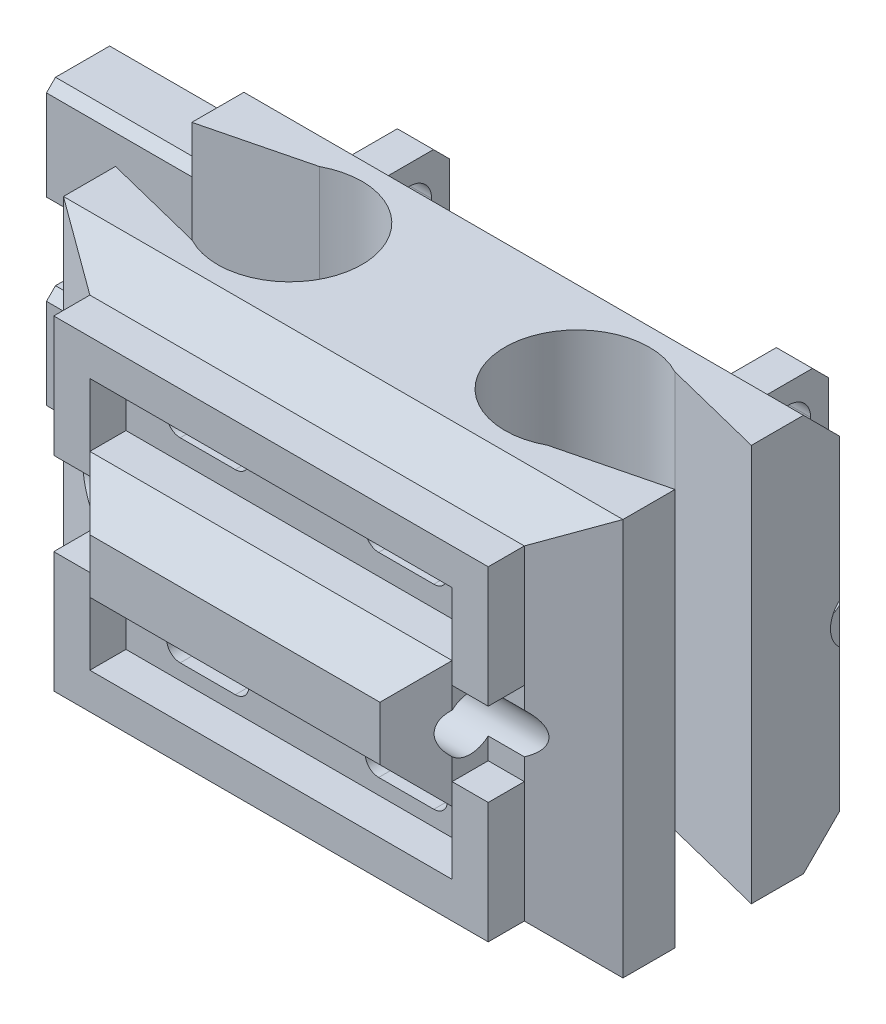
from build123d import *
from OCP.BRepFilletAPI import BRepFilletAPI_MakeChamfer

# Parameters (mm, degrees)
BASE_W                           = 15.5
BASE_H                           = 11
PHALANGE_SHAPE_DEPTH             = 7
CHAMFER4_SIZE                    = 1
CHAMFER5_SIZE                    = 1
CHAMFER5_SIZE2                   = 1.732050808
CHAMFER6_SIZE                    = 1
SKETCH8_W                        = 10.035898384
SKETCH8_H                        = 3.5
LIGAMENT_INSIDE_DEPTH            = 2
LIGAMENT_INSIDE_HOLE_DEPTH       = 4.254422658
LIGAMENT_INSIDE_HOLE_DEPTH_BACK  = 34.5
SKETCH9_R                        = 0.75
CHAMFER9_SIZE                    = 1
SKETCH10_W                       = 13.5
SKETCH10_H                       = 3.5
LIGAMENT_OUTSIDE_DEPTH           = 2
LIGAMENT_OUTSIDE_HOLE_DEPTH      = 2.5
LIGAMENT_OUTSIDE_HOLE_DEPTH_BACK = 36.5
SKETCH11_R                       = 0.75
CHAMFER11_SIZE                   = 1
TENDONS_FIXATION_DEPTH           = 11
SKETCH12_W                       = 1
SKETCH12_H                       = 3.75
BOSS_EXTRUDE7_DEPTH              = 2
TOUCH_SENSOR_WIRE_GAUGE_DEPTH    = 12
CHAMFER12_SIZE                   = 0.3
CHAMFER13_SIZE                   = 0.75
SKETCH15_W                       = 2
SKETCH15_H                       = 3
BOSS_EXTRUDE8_DEPTH              = 4.47
CHAMFER14_SIZE                   = 0.25
CHAMFER15_SIZE                   = 0.5
SKETCH16_W                       = 1
SKETCH16_H                       = 2.345491503
SKETCH16_W_2                     = 12.035898384
SKETCH16_H_2                     = 1
BOSS_EXTRUDE9_DEPTH              = 1
CUT_EXTRUDE1_DEPTH               = 1


with BuildPart() as part:
    # Base → Phalange shape (new body)
    with BuildSketch(Plane.XY):
        with Locations((7.75, 5.5)):
            Rectangle(BASE_W, BASE_H)
    extrude(amount=PHALANGE_SHAPE_DEPTH)

    # Chamfer4
    chamfer4_edges = [part.edges().sort_by_distance(p)[0] for p in [
        (7.75, 11, 7),
        (7.75, 0, 7),
    ]]
    chamfer(chamfer4_edges, length=CHAMFER4_SIZE)

    # Chamfer5: one chamfer whose edges measure the first distance from different faces: ONE call of the kernel's chamfer builder (chamfer() names one face for all edges)
    chamfer5_edges_1 = [part.edges().sort_by_distance(p)[0] for p in [
        (0, 5.5, 7),
    ]]
    chamfer5_side_1 = [part.faces().sort_by_distance(p)[0] for p in [
        (0, 5.5, 3.458333333),
    ]]
    chamfer5_edges_2 = [part.edges().sort_by_distance(p)[0] for p in [
        (15.5, 5.5, 7),
    ]]
    chamfer5_side_2 = [part.faces().sort_by_distance(p)[0] for p in [
        (15.5, 5.5, 3.458333333),
    ]]
    chamfer5 = BRepFilletAPI_MakeChamfer(part.part.solid().wrapped)
    for e in chamfer5_edges_1:
        chamfer5.Add(CHAMFER5_SIZE, CHAMFER5_SIZE2, e.wrapped, chamfer5_side_1[0].wrapped)  # the first distance lies on this face
    for e in chamfer5_edges_2:
        chamfer5.Add(CHAMFER5_SIZE, CHAMFER5_SIZE2, e.wrapped, chamfer5_side_2[0].wrapped)  # the first distance lies on this face
    add(Compound.cast(chamfer5.Shape()), mode=Mode.REPLACE)

    # Chamfer6
    chamfer6_edges = [part.edges().sort_by_distance(p)[0] for p in [
        (7.75, 11, 0),
        (7.75, 0, 0),
    ]]
    chamfer(chamfer6_edges, length=CHAMFER6_SIZE)

    # Sketch8 → Ligament inside (add)
    with BuildSketch(Plane.XY.offset(7)):
        with Locations((7.75, 5.5)):
            Rectangle(SKETCH8_W, SKETCH8_H)
    extrude(amount=LIGAMENT_INSIDE_DEPTH)

    # Sketch9 → Ligament inside hole (cut, two sides: drawn at the far end of the back side and taken through both)
    with BuildSketch(Plane(origin=(12.767949192, 0, 0), x_dir=(0, 0, -1), z_dir=(1, 0, 0)).offset(-LIGAMENT_INSIDE_HOLE_DEPTH_BACK)):
        with Locations(Location((-7.5, 5.5, 0), (0, 0, 311.810314896))):
            Circle(SKETCH9_R)
    extrude(amount=LIGAMENT_INSIDE_HOLE_DEPTH + LIGAMENT_INSIDE_HOLE_DEPTH_BACK, mode=Mode.SUBTRACT)

    # Chamfer9
    # the kernel refuses this chamfer: 1 mm, written as the material it takes off along each edge
    with BuildSketch(Plane(origin=(15.33963218, 3.75, 9), x_dir=(0, -0.027495876610586487, -0.9996219169112968), z_dir=(-1, 0, 0)), Plane(origin=(0.16036782, 7.25, 9), x_dir=(0, 0.027495876610586487, -0.9996219169112968), z_dir=(1, 0, 0))) as chamfer9_piece_1:
        Polygon((CHAMFER9_SIZE * 0.999621916911, -CHAMFER9_SIZE * 0.0274958766106), (-CHAMFER9_SIZE * 0.0274958766106, -CHAMFER9_SIZE * 0.999621916911), (0, 0), align=None)
    extrude(amount=15.179264361, mode=Mode.SUBTRACT)
    with BuildSketch(Plane(origin=(12.767949192, 9.821682988, 9), x_dir=(0.027495876610585623, 0, -0.9996219169112968), z_dir=(0, -1, 0)), Plane(origin=(2.732050808, 1.178317012, 9), x_dir=(-0.027495876610586487, 0, -0.9996219169112968), z_dir=(0, 1, 0))) as chamfer9_piece_2:
        Polygon((CHAMFER9_SIZE * 0.999621916911, -CHAMFER9_SIZE * 0.0274958766106), (-CHAMFER9_SIZE * 0.0274958766106, -CHAMFER9_SIZE * 0.999621916911), (0, 0), align=None)
    extrude(amount=8.643365976, mode=Mode.SUBTRACT)

    # Sketch10 → Ligament outside (add)
    with BuildSketch(Plane(origin=(0, 0, 0), x_dir=(-1, 0, 0), z_dir=(0, 0, -1))):
        with Locations((-7.75, 5.5)):
            Rectangle(SKETCH10_W, SKETCH10_H)
    extrude(amount=LIGAMENT_OUTSIDE_DEPTH)

    # Sketch11 → Ligament outside hole (cut, two sides: drawn at the far end of the back side and taken through both)
    with BuildSketch(Plane.ZY.offset(-1).offset(-LIGAMENT_OUTSIDE_HOLE_DEPTH_BACK)):
        with Locations(Location((-0.5, 5.5, 0), (0, 0, 48.189685104))):
            Circle(SKETCH11_R)
    extrude(amount=LIGAMENT_OUTSIDE_HOLE_DEPTH + LIGAMENT_OUTSIDE_HOLE_DEPTH_BACK, mode=Mode.SUBTRACT)

    # Chamfer11
    # the kernel refuses this chamfer: 1 mm, written as the material it takes off along each edge
    with BuildSketch(Plane(origin=(14.5, 9.821682988, -2), x_dir=(0.027495876610585623, 0, 0.9996219169112968), z_dir=(0, -1, 0)), Plane(origin=(1, 1.178317012, -2), x_dir=(-0.02749587661058638, 0, 0.9996219169112968), z_dir=(0, 1, 0))) as chamfer11_piece_1:
        Polygon((CHAMFER11_SIZE * 0.999621916911, CHAMFER11_SIZE * 0.0274958766106), (-CHAMFER11_SIZE * 0.0274958766106, CHAMFER11_SIZE * 0.999621916911), (0, 0), align=None)
    extrude(amount=8.643365976, mode=Mode.SUBTRACT)
    with BuildSketch(Plane(origin=(17.071682988, 3.75, -2), x_dir=(0, -0.027495876610586487, 0.9996219169112968), z_dir=(-1, 0, 0)), Plane(origin=(-1.571682988, 7.25, -2), x_dir=(0, 0.027495876610586487, 0.9996219169112968), z_dir=(1, 0, 0))) as chamfer11_piece_2:
        Polygon((CHAMFER11_SIZE * 0.999621916911, CHAMFER11_SIZE * 0.0274958766106), (-CHAMFER11_SIZE * 0.0274958766106, CHAMFER11_SIZE * 0.999621916911), (0, 0), align=None)
    extrude(amount=18.643365976, mode=Mode.SUBTRACT)

    # Tendon extrude → Tendons fixation (cut)
    with BuildSketch(Plane.XZ):
        with BuildLine():
            Line((2.828823529, 5.264705882), (0, 4.5575))
            Line((0, 4.5575), (0, 2.4425))
            Line((0, 2.4425), (2.828823529, 1.735294118))
            ThreePointArc((2.828823529, 1.735294118), (5.77, 3.5), (2.828823529, 5.264705882))
        make_face()
        with BuildLine():
            Line((12.671176471, 1.735294118), (15.5, 2.4425))
            Line((15.5, 2.4425), (15.5, 4.5575))
            Line((15.5, 4.5575), (12.671176471, 5.264705882))
            ThreePointArc((12.671176471, 5.264705882), (9.73, 3.5), (12.671176471, 1.735294118))
        make_face()
    extrude(amount=-TENDONS_FIXATION_DEPTH, mode=Mode.SUBTRACT)

    # Sketch12 → Boss-Extrude7 (add)
    with BuildSketch(Plane(origin=(0, 0, 0), x_dir=(-1, 0, 0), z_dir=(0, 0, -1))):
        with Locations((-2.5, 8.125)):
            Rectangle(SKETCH12_W, SKETCH12_H)
        with Locations((-2.5, 2.875)):
            Rectangle(SKETCH12_W, SKETCH12_H)
        with Locations((-13, 2.875)):
            Rectangle(SKETCH12_W, SKETCH12_H)
        with Locations((-13, 8.125)):
            Rectangle(SKETCH12_W, SKETCH12_H)
    extrude(amount=BOSS_EXTRUDE7_DEPTH)

    # Sketch13 → Touch sensor wire gauge (cut)
    with BuildSketch(Plane.ZY.offset(-2)):
        with BuildLine():
            Line((0, 8.85), (0, 7.85))
            ThreePointArc((0, 7.85), (-0.6, 7.25), (-1.2, 7.85))
            Line((-1.2, 7.85), (-1.2, 8.85))
            ThreePointArc((-1.2, 8.85), (-0.6, 9.45), (0, 8.85))
        make_face()
        with BuildLine():
            Line((0, 3.15), (0, 2.15))
            ThreePointArc((0, 2.15), (-0.6, 1.55), (-1.2, 2.15))
            Line((-1.2, 2.15), (-1.2, 3.15))
            ThreePointArc((-1.2, 3.15), (-0.6, 3.75), (0, 3.15))
        make_face()
    extrude(amount=-TOUCH_SENSOR_WIRE_GAUGE_DEPTH, mode=Mode.SUBTRACT)

    # Chamfer12
    # the kernel refuses this chamfer: 0.3 mm, written as the material it takes off along each edge
    with BuildSketch(Plane(origin=(2, 6.25, -2), x_dir=(-0.027495876610586622, 0, 0.9996219169112968), z_dir=(0, 1, 0))) as chamfer12_piece_1_section:
        Polygon((CHAMFER12_SIZE * 0.999621916911, CHAMFER12_SIZE * 0.0274958766106), (-CHAMFER12_SIZE * 0.0274958766106, CHAMFER12_SIZE * 0.999621916911), (0, 0), align=None)
    chamfer12_piece_1 = extrude(amount=4.521504896, mode=Mode.PRIVATE)
    chamfer12_piece_1 = split(chamfer12_piece_1, bisect_by=Plane(origin=(2.100684932, 7.261472603, -0.988527397), z_dir=(0, 0.7071067811862649, -0.7071067811868302)), keep=Keep.TOP, mode=Mode.PRIVATE)
    add(chamfer12_piece_1, mode=Mode.SUBTRACT)
    with BuildSketch(Plane(origin=(3, 10.771504896, -2), x_dir=(0.027495876610585904, 0, 0.9996219169112968), z_dir=(0, -1, 0))) as chamfer12_piece_2_section:
        Polygon((CHAMFER12_SIZE * 0.999621916911, CHAMFER12_SIZE * 0.0274958766106), (-CHAMFER12_SIZE * 0.0274958766106, CHAMFER12_SIZE * 0.999621916911), (0, 0), align=None)
    chamfer12_piece_2 = extrude(amount=5.293009793, mode=Mode.PRIVATE)
    chamfer12_piece_2 = split(chamfer12_piece_2, bisect_by=Plane(origin=(2.899315068, 7.261472603, -0.988527397), z_dir=(0, 0.7071067811862649, -0.7071067811868302)), keep=Keep.TOP, mode=Mode.PRIVATE)
    add(chamfer12_piece_2, mode=Mode.SUBTRACT)
    with BuildSketch(Plane(origin=(2, 0.228495104, -2), x_dir=(-0.027495876610586622, 0, 0.9996219169112968), z_dir=(0, 1, 0))) as chamfer12_piece_3_section:
        Polygon((CHAMFER12_SIZE * 0.999621916911, CHAMFER12_SIZE * 0.0274958766106), (-CHAMFER12_SIZE * 0.0274958766106, CHAMFER12_SIZE * 0.999621916911), (0, 0), align=None)
    chamfer12_piece_3 = extrude(amount=4.521504896, mode=Mode.PRIVATE)
    chamfer12_piece_3 = split(chamfer12_piece_3, bisect_by=Plane(origin=(2.100684932, 3.738527397, -0.988527397), z_dir=(0, -0.7071067811862649, -0.7071067811868302)), keep=Keep.TOP, mode=Mode.PRIVATE)
    add(chamfer12_piece_3, mode=Mode.SUBTRACT)
    with BuildSketch(Plane(origin=(3, 5.521504896, -2), x_dir=(-0.9996219169112968, 0, -0.027495876610585942), z_dir=(0, -1, 0))) as chamfer12_piece_4_section:
        Polygon((CHAMFER12_SIZE * 0.999621916911, -CHAMFER12_SIZE * 0.0274958766106), (-CHAMFER12_SIZE * 0.0274958766106, -CHAMFER12_SIZE * 0.999621916911), (0, 0), align=None)
    chamfer12_piece_4 = extrude(amount=5.293009793, mode=Mode.PRIVATE)
    chamfer12_piece_4 = split(chamfer12_piece_4, bisect_by=Plane(origin=(2.899315068, 3.738527397, -0.988527397), z_dir=(0, -0.7071067811862649, -0.7071067811868302)), keep=Keep.TOP, mode=Mode.PRIVATE)
    add(chamfer12_piece_4, mode=Mode.SUBTRACT)
    with BuildSketch(Plane(origin=(13.5, 4.75, -2), x_dir=(0.027495876610584464, 0, 0.9996219169112968), z_dir=(0, -1, 0))) as chamfer12_piece_5_section:
        Polygon((CHAMFER12_SIZE * 0.999621916911, CHAMFER12_SIZE * 0.0274958766106), (-CHAMFER12_SIZE * 0.0274958766106, CHAMFER12_SIZE * 0.999621916911), (0, 0), align=None)
    chamfer12_piece_5 = extrude(amount=4.521504896, mode=Mode.PRIVATE)
    chamfer12_piece_5 = split(chamfer12_piece_5, bisect_by=Plane(origin=(13.399315068, 3.738527397, -0.988527397), z_dir=(0, -0.7071067811862649, -0.7071067811868302)), keep=Keep.TOP, mode=Mode.PRIVATE)
    add(chamfer12_piece_5, mode=Mode.SUBTRACT)
    with BuildSketch(Plane(origin=(12.5, 0.228495104, -2), x_dir=(-0.027495876610584464, 0, 0.9996219169112968), z_dir=(0, 1, 0))) as chamfer12_piece_6_section:
        Polygon((CHAMFER12_SIZE * 0.999621916911, CHAMFER12_SIZE * 0.0274958766106), (-CHAMFER12_SIZE * 0.0274958766106, CHAMFER12_SIZE * 0.999621916911), (0, 0), align=None)
    chamfer12_piece_6 = extrude(amount=5.293009793, mode=Mode.PRIVATE)
    chamfer12_piece_6 = split(chamfer12_piece_6, bisect_by=Plane(origin=(12.600684932, 3.738527397, -0.988527397), z_dir=(0, -0.7071067811862649, -0.7071067811868302)), keep=Keep.TOP, mode=Mode.PRIVATE)
    add(chamfer12_piece_6, mode=Mode.SUBTRACT)
    with BuildSketch(Plane(origin=(13.5, 6.25, -2), x_dir=(0.027495876610584464, 0, 0.9996219169112968), z_dir=(0, 1, 0))) as chamfer12_piece_7_section:
        Polygon((CHAMFER12_SIZE * 0.999621916911, -CHAMFER12_SIZE * 0.0274958766106), (-CHAMFER12_SIZE * 0.0274958766106, -CHAMFER12_SIZE * 0.999621916911), (0, 0), align=None)
    chamfer12_piece_7 = extrude(amount=4.521504896, mode=Mode.PRIVATE)
    chamfer12_piece_7 = split(chamfer12_piece_7, bisect_by=Plane(origin=(13.399315068, 7.261472603, -0.988527397), z_dir=(0, 0.7071067811862649, -0.7071067811868302)), keep=Keep.TOP, mode=Mode.PRIVATE)
    add(chamfer12_piece_7, mode=Mode.SUBTRACT)
    with BuildSketch(Plane(origin=(12.5, 10.771504896, -2), x_dir=(-0.027495876610584464, 0, 0.9996219169112968), z_dir=(0, -1, 0))) as chamfer12_piece_8_section:
        Polygon((CHAMFER12_SIZE * 0.999621916911, -CHAMFER12_SIZE * 0.0274958766106), (-CHAMFER12_SIZE * 0.0274958766106, -CHAMFER12_SIZE * 0.999621916911), (0, 0), align=None)
    chamfer12_piece_8 = extrude(amount=5.293009793, mode=Mode.PRIVATE)
    chamfer12_piece_8 = split(chamfer12_piece_8, bisect_by=Plane(origin=(12.600684932, 7.261472603, -0.988527397), z_dir=(0, 0.7071067811862649, -0.7071067811868302)), keep=Keep.TOP, mode=Mode.PRIVATE)
    add(chamfer12_piece_8, mode=Mode.SUBTRACT)

    # Chamfer13
    chamfer13_edges = [part.edges().sort_by_distance(p)[0] for p in [
        (13, 10, -2),
        (13, 1, -2),
        (2.5, 1, -2),
        (2.5, 10, -2),
    ]]
    chamfer(chamfer13_edges, length=CHAMFER13_SIZE)

    # Sketch15 → Boss-Extrude8 (add)
    with BuildSketch(Plane.ZY):
        with Locations((1, 8)):
            Rectangle(SKETCH15_W, SKETCH15_H)
        with Locations((1, 3)):
            Rectangle(SKETCH15_W, SKETCH15_H)
    extrude(amount=BOSS_EXTRUDE8_DEPTH)

    # Chamfer14
    chamfer14_edges = [part.edges().sort_by_distance(p)[0] for p in [
        (-2.235, 4.5, 0),
        (-2.235, 1.5, 0),
        (-2.235, 1.5, 2),
        (-2.235, 4.5, 2),
        (-2.235, 9.5, 0),
        (-2.235, 6.5, 0),
        (-2.235, 6.5, 2),
        (-2.235, 9.5, 2),
    ]]
    chamfer(chamfer14_edges, length=CHAMFER14_SIZE)

    # Chamfer15
    chamfer15_edges = [part.edges().sort_by_distance(p)[0] for p in [
        (0, 6.5, 1),
        (0, 9.5, 1),
        (0, 4.5, 1),
        (0, 1.5, 1),
    ]]
    chamfer(chamfer15_edges, length=CHAMFER15_SIZE)

    # Sketch16 → Boss-Extrude9 (add)
    with BuildSketch(Plane.XY.offset(7)):
        Polygon((1.732050808, 4.345491503), (1.732050808, 2), (2.732050808, 2), (2.732050808, 3.75), (2.732050808, 4.345491503), align=None)
        Polygon((1.732050808, 2), (1.732050808, 1), (13.767949192, 1), (13.767949192, 2), (12.767949192, 2), (2.732050808, 2), align=None)
        Polygon((12.767949192, 2), (13.767949192, 2), (13.767949192, 4.345491503), (12.767949192, 4.345491503), (12.767949192, 3.75), align=None)
        with Locations((13.267949192, 7.827254249)):
            Rectangle(SKETCH16_W, SKETCH16_H)
        with Locations((7.75, 9.5)):
            Rectangle(SKETCH16_W_2, SKETCH16_H_2)
        with Locations((2.232050808, 7.827254249)):
            Rectangle(SKETCH16_W, SKETCH16_H)
    extrude(amount=BOSS_EXTRUDE9_DEPTH)

    # Sketch17 → Cut-Extrude1 (cut)
    with BuildSketch(Plane.XY.offset(7)):
        with BuildLine():
            Line((4.234456067, 8.571603172), (5.76245347, 8.571603172))
            ThreePointArc((5.76245347, 8.571603172), (6.134056642, 8.2), (5.76245347, 7.828396828))
            Line((5.76245347, 7.828396828), (4.234456067, 7.828396828))
            ThreePointArc((4.234456067, 7.828396828), (3.862852895, 8.2), (4.234456067, 8.571603172))
        make_face()
        with BuildLine():
            Line((9.733560051, 8.571603172), (11.261557454, 8.571603172))
            ThreePointArc((11.261557454, 8.571603172), (11.633160626, 8.2), (11.261557454, 7.828396828))
            Line((11.261557454, 7.828396828), (9.733560051, 7.828396828))
            ThreePointArc((9.733560051, 7.828396828), (9.361956879, 8.2), (9.733560051, 8.571603172))
        make_face()
        with BuildLine():
            Line((4.234456067, 3.171603172), (5.76245347, 3.171603172))
            ThreePointArc((5.76245347, 3.171603172), (6.134056642, 2.8), (5.76245347, 2.428396828))
            Line((5.76245347, 2.428396828), (4.234456067, 2.428396828))
            ThreePointArc((4.234456067, 2.428396828), (3.862852895, 2.8), (4.234456067, 3.171603172))
        make_face()
        with BuildLine():
            Line((9.733560051, 3.171603172), (11.261557454, 3.171603172))
            ThreePointArc((11.261557454, 3.171603172), (11.633160626, 2.8), (11.261557454, 2.428396828))
            Line((11.261557454, 2.428396828), (9.733560051, 2.428396828))
            ThreePointArc((9.733560051, 2.428396828), (9.361956879, 2.8), (9.733560051, 3.171603172))
        make_face()
    extrude(amount=-CUT_EXTRUDE1_DEPTH, mode=Mode.SUBTRACT)


solid = part.part
